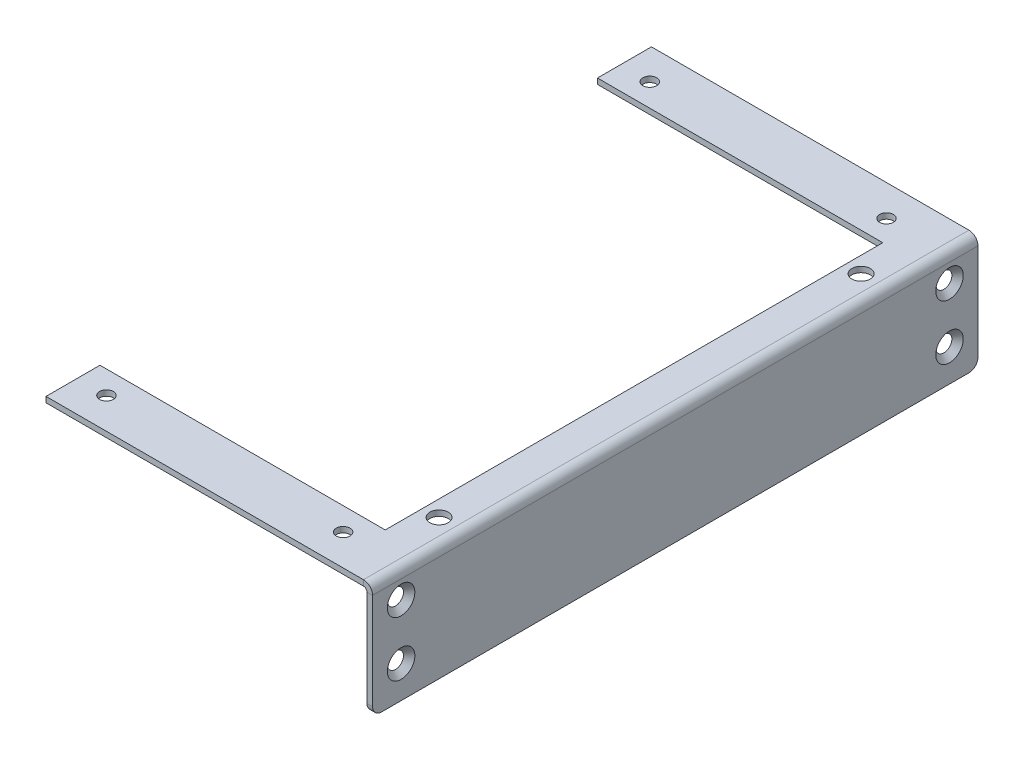
from build123d import *

# Parameters (mm, degrees)
SKETCH1_W                                            = 71.22
SKETCH1_H                                            = 132.04
BASE_FLANGE1_DEPTH                                   = 1.2192
EDGE_FLANGE1_STRIP_W                                 = 6.3968
EDGE_FLANGE1_STRIP_H                                 = 1.2192
EDGE_FLANGE1_STRIP_CUT_DEPTH                         = 132.04
EDGE_FLANGE1_DEPTH                                   = 132.04
CUT_EXTRUDE2_REACH                                   = 154.088
SKETCH28_W                                           = 62.22
SKETCH28_H                                           = 108.5
CSK_FOR_M3_CROSS_COUNTERSUNK_HEAD_SCREW4_D           = 3.4
CSK_FOR_M3_CROSS_COUNTERSUNK_HEAD_SCREW4_CSINK_D     = 6
CSK_FOR_M3_CROSS_COUNTERSUNK_HEAD_SCREW4_CSINK_ANGLE = 92
F_3_0MM_DOWEL_HOLE1_D                                = 3
CUT_EXTRUDE3_REACH                                   = 154.088
F_4_0MM_DOWEL_HOLE1_D                                = 4


# Sheet-metal steps are written as plain solids
with BuildPart() as part:
    # Sketch1 → Base-Flange1 (new body)
    with BuildSketch(Plane(origin=(0, 0, 0), x_dir=(1, 0, 0), z_dir=(0, 1, 0))):
        with Locations((35.61, 66.02)):
            Rectangle(SKETCH1_W, SKETCH1_H)
    extrude(amount=-BASE_FLANGE1_DEPTH)

    # Edge-Flange1 strip (across the edge) → Edge-Flange1 strip cut (cut)
    with BuildSketch(Plane(origin=(71.22, -1.2192, -132.04), x_dir=(-1, 0, 0), z_dir=(0, 0, 1))):
        with Locations((-1.2192, -0.6096)):
            Rectangle(EDGE_FLANGE1_STRIP_W, EDGE_FLANGE1_STRIP_H)
    extrude(amount=EDGE_FLANGE1_STRIP_CUT_DEPTH, mode=Mode.SUBTRACT)

    # Edge-Flange1 section (across the edge) → Edge-Flange1 (add)
    with BuildSketch(Plane(origin=(71.22, -1.2192, -132.04), x_dir=(-1, 0, 0), z_dir=(0, 0, 1))):
        with BuildLine():
            Line((0, 0.76), (0, 23.76))
            Line((0, 23.76), (1.2192, 23.76))
            Line((1.2192, 23.76), (1.2192, 0.76))
            ThreePointArc((1.2192, 0.76), (1.441798846, 0.222598846), (1.9792, 0))
            Line((1.9792, 0), (1.9792, -1.2192))
            ThreePointArc((1.9792, -1.2192), (0.579694259, -0.639505741), (0, 0.76))
        make_face()
    extrude(amount=EDGE_FLANGE1_DEPTH)

    # Sketch28 → Cut-Extrude2 (cut, up to next)
    with BuildSketch(Plane(origin=(0, 0, 0), x_dir=(1, 0, 0), z_dir=(0, 1, 0)), mode=Mode.PRIVATE) as cut_extrude2_sk1:
        with Locations((31.11, 66.02)):
            Rectangle(SKETCH28_W, SKETCH28_H)
    cut_extrude2_tool1 = extrude(cut_extrude2_sk1.sketch, amount=-CUT_EXTRUDE2_REACH, mode=Mode.PRIVATE) & part.part
    add(cut_extrude2_tool1.solids().sort_by_distance((31.11, 0, -66.02))[0], mode=Mode.SUBTRACT)

    # CSK for M3 Cross Countersunk Head Screw4 (through all)
    with Locations(Plane(origin=(71.22, -5.9492, -6.22), x_dir=(0, 1, 0), z_dir=(1, 0, 0))):
        with Locations((0, 0), (-12, 0), (0, -119.6), (-12, -119.6)):
            CounterSinkHole(CSK_FOR_M3_CROSS_COUNTERSUNK_HEAD_SCREW4_D / 2, CSK_FOR_M3_CROSS_COUNTERSUNK_HEAD_SCREW4_CSINK_D / 2, counter_sink_angle=CSK_FOR_M3_CROSS_COUNTERSUNK_HEAD_SCREW4_CSINK_ANGLE)

    # Ø3.0mm Dowel Hole1 (through all)
    with Locations(Plane(origin=(6.41, 0, -125.27), x_dir=(0, 0, 1), z_dir=(0, 1, 0))):
        with Locations((0, 0), (0, 51.62), (118.5, 51.62), (118.5, 0)):
            Hole(F_3_0MM_DOWEL_HOLE1_D / 2)

    # Sketch35 → Cut-Extrude3 (cut, up to next)
    with BuildSketch(Plane(origin=(71.22, 0, 0), x_dir=(0, 0, -1), z_dir=(1, 0, 0)), mode=Mode.PRIVATE) as cut_extrude3_sk1:
        with BuildLine():
            Line((0, -24.9792), (1.98, -24.9792))
            ThreePointArc((1.98, -24.9792), (0.579928573, -24.399271427), (0, -22.9992))
            Line((0, -22.9992), (0, -24.9792))
        make_face()
    cut_extrude3_tool1 = extrude(cut_extrude3_sk1.sketch, amount=-CUT_EXTRUDE3_REACH, mode=Mode.PRIVATE) & part.part
    # Sketch35 → Cut-Extrude3 (cut, up to next)
    with BuildSketch(Plane(origin=(71.22, 0, 0), x_dir=(0, 0, -1), z_dir=(1, 0, 0)), mode=Mode.PRIVATE) as cut_extrude3_sk2:
        with BuildLine():
            Line((132.04, -24.9792), (130.06, -24.9792))
            ThreePointArc((130.06, -24.9792), (131.460071427, -24.399271427), (132.04, -22.9992))
            Line((132.04, -22.9992), (132.04, -24.9792))
        make_face()
    cut_extrude3_tool2 = extrude(cut_extrude3_sk2.sketch, amount=-CUT_EXTRUDE3_REACH, mode=Mode.PRIVATE) & part.part
    add(cut_extrude3_tool1.solids().sort_by_distance((71.22, -24.536931, -0.442269))[0], mode=Mode.SUBTRACT)
    add(cut_extrude3_tool2.solids().sort_by_distance((71.22, -24.536931, -131.597731))[0], mode=Mode.SUBTRACT)

    # Ø4.0mm Dowel Hole1 (through all)
    with Locations(Plane(origin=(0, 0, 0), x_dir=(1, 0, 0), z_dir=(0, 1, 0))):
        with Locations((65.72, 112.04), (65.72, 20)):
            Hole(F_4_0MM_DOWEL_HOLE1_D / 2)


solid = part.part
